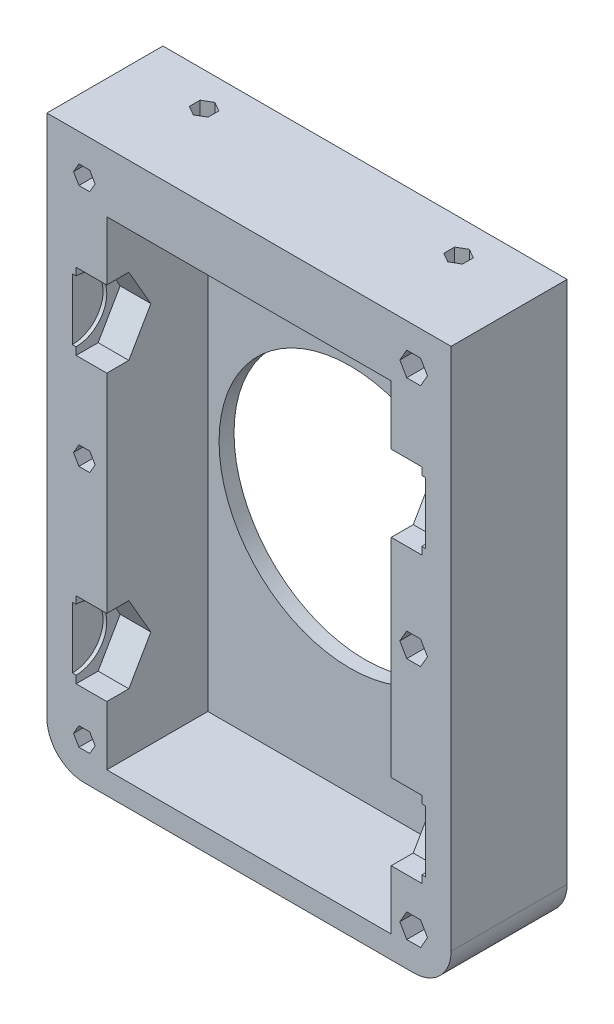
from build123d import *

# Parameters (mm, degrees)
SKETCH1_W           = 54
SKETCH1_H           = 75
SKETCH1_W_2         = 38
SKETCH1_H_2         = 64
BOSS_EXTRUDE1_DEPTH = 27
CUT_EXTRUDE1_DEPTH  = 4.1
SKETCH5_R           = 4.1
CUT_EXTRUDE2_DEPTH  = 0.5
CUT_EXTRUDE3_DEPTH  = 4.1
CUT_EXTRUDE4_START  = -0.5
SKETCH7_R           = 4.1
CUT_EXTRUDE4_DEPTH  = 0.5
SKETCH8_W           = 54
SKETCH8_H           = 75
BOSS_EXTRUDE2_DEPTH = 2
SKETCH9_W           = 54
SKETCH9_H           = 75
BOSS_EXTRUDE3_DEPTH = 2
SKETCH10_W          = 54
SKETCH10_H          = 75
CUT_EXTRUDE5_DEPTH  = 15.5
SKETCH11_R          = 17.5
CUT_EXTRUDE6_DEPTH  = 94.398340456
CUT_EXTRUDE7_DEPTH  = 94.70832407
SKETCH14_W          = 38
SKETCH14_H          = 5
BOSS_EXTRUDE4_DEPTH = 4
CUT_EXTRUDE8_REACH  = 95.398
FILLET1_R           = 5


with BuildPart() as part:
    # Sketch1 → Boss-Extrude1 (new body)
    with BuildSketch(Plane.XY):
        with Locations((27, 37.5)):
            Rectangle(SKETCH1_W, SKETCH1_H)
        with Locations((27, 35)):
            Rectangle(SKETCH1_W_2, SKETCH1_H_2, mode=Mode.SUBTRACT)
    extrude(amount=BOSS_EXTRUDE1_DEPTH)

    # Sketch2 → Cut-Extrude1 (cut)
    with BuildSketch(Plane.ZY.offset(-46)):
        Polygon((19.388972746, 54), (16.444486373, 59.1), (10.555513627, 59.1), (7.611027254, 54), (10.555513627, 48.9), (16.444486373, 48.9), align=None)
        Polygon((19.388972746, 16), (16.444486373, 21.1), (10.555513627, 21.1), (7.611027254, 16), (10.555513627, 10.9), (16.444486373, 10.9), align=None)
    extrude(amount=-CUT_EXTRUDE1_DEPTH, mode=Mode.SUBTRACT)

    # Sketch5 → Cut-Extrude2 (cut)
    with BuildSketch(Plane.ZY.offset(-50.1)):
        with Locations((13.5, 54)):
            Circle(SKETCH5_R)
        with Locations((13.5, 16)):
            Circle(SKETCH5_R)
    extrude(amount=-CUT_EXTRUDE2_DEPTH, mode=Mode.SUBTRACT)

    # Sketch6 → Cut-Extrude3 (cut)
    with BuildSketch(Plane(origin=(8, 0, 0), x_dir=(0, 0, -1), z_dir=(1, 0, 0))):
        Polygon((-7.611027254, 54), (-10.555513627, 59.1), (-16.444486373, 59.1), (-19.388972746, 54), (-16.444486373, 48.9), (-10.555513627, 48.9), align=None)
        Polygon((-7.611027254, 16), (-10.555513627, 21.1), (-16.444486373, 21.1), (-19.388972746, 16), (-16.444486373, 10.9), (-10.555513627, 10.9), align=None)
    extrude(amount=-CUT_EXTRUDE3_DEPTH, mode=Mode.SUBTRACT)

    # Sketch7 → Cut-Extrude4 (cut)
    with BuildSketch(Plane(origin=(3.9, 0, 0), x_dir=(0, 0, -1), z_dir=(1, 0, 0)).offset(CUT_EXTRUDE4_START)):
        with Locations((-13.5, 54)):
            Circle(SKETCH7_R)
        with Locations((-13.5, 16)):
            Circle(SKETCH7_R)
    extrude(amount=CUT_EXTRUDE4_DEPTH, mode=Mode.SUBTRACT)

    # Sketch8 → Boss-Extrude2 (add)
    with BuildSketch(Plane.XY.offset(27)):
        with Locations((27, 37.5)):
            Rectangle(SKETCH8_W, SKETCH8_H)
    extrude(amount=BOSS_EXTRUDE2_DEPTH)

    # Sketch9 → Boss-Extrude3 (add)
    with BuildSketch(Plane(origin=(0, 0, 0), x_dir=(-1, 0, 0), z_dir=(0, 0, -1))):
        with Locations((-27, 37.5)):
            Rectangle(SKETCH9_W, SKETCH9_H)
    extrude(amount=BOSS_EXTRUDE3_DEPTH)

    # Sketch10 → Cut-Extrude5 (cut)
    with BuildSketch(Plane.XY.offset(29)):
        with Locations((27, 37.5)):
            Rectangle(SKETCH10_W, SKETCH10_H)
    extrude(amount=-CUT_EXTRUDE5_DEPTH, mode=Mode.SUBTRACT)

    # Sketch11 → Cut-Extrude6 (cut, through all)
    with BuildSketch(Plane.XY):
        with Locations((27, 35)):
            Circle(SKETCH11_R)
    extrude(amount=-CUT_EXTRUDE6_DEPTH, mode=Mode.SUBTRACT)

    # Sketch12 → Cut-Extrude7 (cut, through all)
    with BuildSketch(Plane.XY.offset(13.5)):
        Polygon((6.443375673, 70), (5.721687836, 71.25), (4.278312164, 71.25), (3.556624327, 70), (4.278312164, 68.75), (5.721687836, 68.75), align=None)
        Polygon((50.847520861, 70), (49.923760431, 71.6), (48.076239569, 71.6), (47.152479139, 70), (48.076239569, 68.4), (49.923760431, 68.4), align=None)
        Polygon((6.443375673, 5), (5.721687836, 6.25), (4.278312164, 6.25), (3.556624327, 5), (4.278312164, 3.75), (5.721687836, 3.75), align=None)
        Polygon((50.847520861, 5), (49.923760431, 6.6), (48.076239569, 6.6), (47.152479139, 5), (48.076239569, 3.4), (49.923760431, 3.4), align=None)
        Polygon((50.847520861, 37.5), (49.923760431, 39.1), (48.076239569, 39.1), (47.152479139, 37.5), (48.076239569, 35.9), (49.923760431, 35.9), align=None)
        Polygon((6.443375673, 37.5), (5.721687836, 38.75), (4.278312164, 38.75), (3.556624327, 37.5), (4.278312164, 36.25), (5.721687836, 36.25), align=None)
    extrude(amount=-CUT_EXTRUDE7_DEPTH, mode=Mode.SUBTRACT)

    # Sketch14 → Boss-Extrude4 (add)
    with BuildSketch(Plane.XZ.offset(-67)):
        with Locations((27, 2.5)):
            Rectangle(SKETCH14_W, SKETCH14_H)
    extrude(amount=BOSS_EXTRUDE4_DEPTH)

    # Sketch13 → Cut-Extrude8 (cut, up to next)
    with BuildSketch(Plane(origin=(0, 75, 0), x_dir=(1, 0, 0), z_dir=(0, 1, 0)), mode=Mode.PRIVATE) as cut_extrude8_sk1:
        Polygon((44, -1.056624327), (42.75, -1.778312164), (42.75, -3.221687836), (44, -3.943375673), (45.25, -3.221687836), (45.25, -1.778312164), align=None)
    cut_extrude8_tool1 = extrude(cut_extrude8_sk1.sketch, amount=-CUT_EXTRUDE8_REACH, mode=Mode.PRIVATE) & part.part
    # Sketch13 → Cut-Extrude8 (cut, up to next)
    with BuildSketch(Plane(origin=(0, 75, 0), x_dir=(1, 0, 0), z_dir=(0, 1, 0)), mode=Mode.PRIVATE) as cut_extrude8_sk2:
        Polygon((10, -1.056624327), (8.75, -1.778312164), (8.75, -3.221687836), (10, -3.943375673), (11.25, -3.221687836), (11.25, -1.778312164), align=None)
    cut_extrude8_tool2 = extrude(cut_extrude8_sk2.sketch, amount=-CUT_EXTRUDE8_REACH, mode=Mode.PRIVATE) & part.part
    add(cut_extrude8_tool1.solids().sort_by_distance((44, 75, 2.5))[0], mode=Mode.SUBTRACT)
    add(cut_extrude8_tool2.solids().sort_by_distance((10, 75, 2.5))[0], mode=Mode.SUBTRACT)

    # Fillet1
    fillet1_edges = [part.edges().sort_by_distance(p)[0] for p in [
        (54, 0, 5.75),
        (0, 0, 5.75),
    ]]
    fillet(fillet1_edges, radius=FILLET1_R)


solid = part.part
